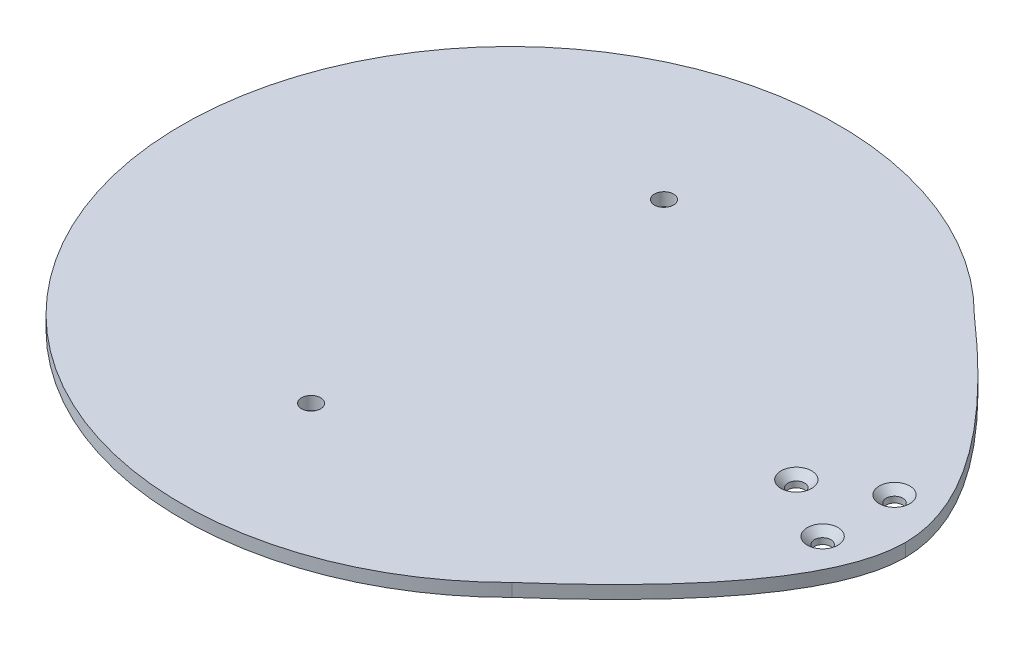
from build123d import *

# Parameters (mm, degrees)
AUFSATZ_LINEAR_AUSTRAGEN1_DEPTH = 2.5
SKIZZE2_R                       = 1.6
SCHNITT_LINEAR_AUSTRAGEN1_DEPTH = 102.387999648
FASE1_SIZE                      = 1.35
SKIZZE3_R                       = 1.85
SCHNITT_LINEAR_AUSTRAGEN2_DEPTH = 102.387999648


with BuildPart() as part:
    # Skizze1 → Aufsatz-Linear austragen1 (new body)
    with BuildSketch(Plane(origin=(0, 0, 0), x_dir=(1, 0, 0), z_dir=(0, 1, 0))):
        with BuildLine():
            ThreePointArc((28.970752729, 44.527564532), (-79.200181402, 0.000357393), (28.970752729, -44.526849746))
            Line((28.970752729, -44.526849746), (28.970752729, -44.530261837))
            add(Edge.make_bspline(
                [(28.970752729, -44.530261837), (60.189363801, -17.15173776), (60.189363801, 17.149040455), (28.970752729, 44.527564532)],
                knots=[0, 0, 0, 1, 2, 2, 2], degree=2))
        make_face()
    extrude(amount=AUFSATZ_LINEAR_AUSTRAGEN1_DEPTH)

    # Skizze2 → Schnitt-Linear austragen1 (cut, through all)
    with BuildSketch(Plane(origin=(0, 2.5, 0), x_dir=(1, 0, 0), z_dir=(0, 1, 0))):
        with Locations((51.189363801, 6.926854578)):
            Circle(SKIZZE2_R)
        with Locations((39.189363801, -0.001348653)):
            Circle(SKIZZE2_R)
        with Locations((51.189363801, -6.929551883)):
            Circle(SKIZZE2_R)
    extrude(amount=-SCHNITT_LINEAR_AUSTRAGEN1_DEPTH, mode=Mode.SUBTRACT)

    # Fase1
    fase1_edges = [part.edges().sort_by_distance(p)[0] for p in [
        (49.589363801, 2.5, 6.929551883),
        (37.589363801, 2.5, 0.001348653),
        (49.589363801, 2.5, -6.926854578),
    ]]
    chamfer(fase1_edges, length=FASE1_SIZE)

    # Skizze3 → Schnitt-Linear austragen2 (cut, through all)
    with BuildSketch(Plane(origin=(0, 2.5, 0), x_dir=(1, 0, 0), z_dir=(0, 1, 0))):
        with Locations((-20.310636199, 33.998651347)):
            Circle(SKIZZE3_R)
        with Locations((-20.310636199, -34.001348653)):
            Circle(SKIZZE3_R)
    extrude(amount=-SCHNITT_LINEAR_AUSTRAGEN2_DEPTH, mode=Mode.SUBTRACT)


solid = part.part
